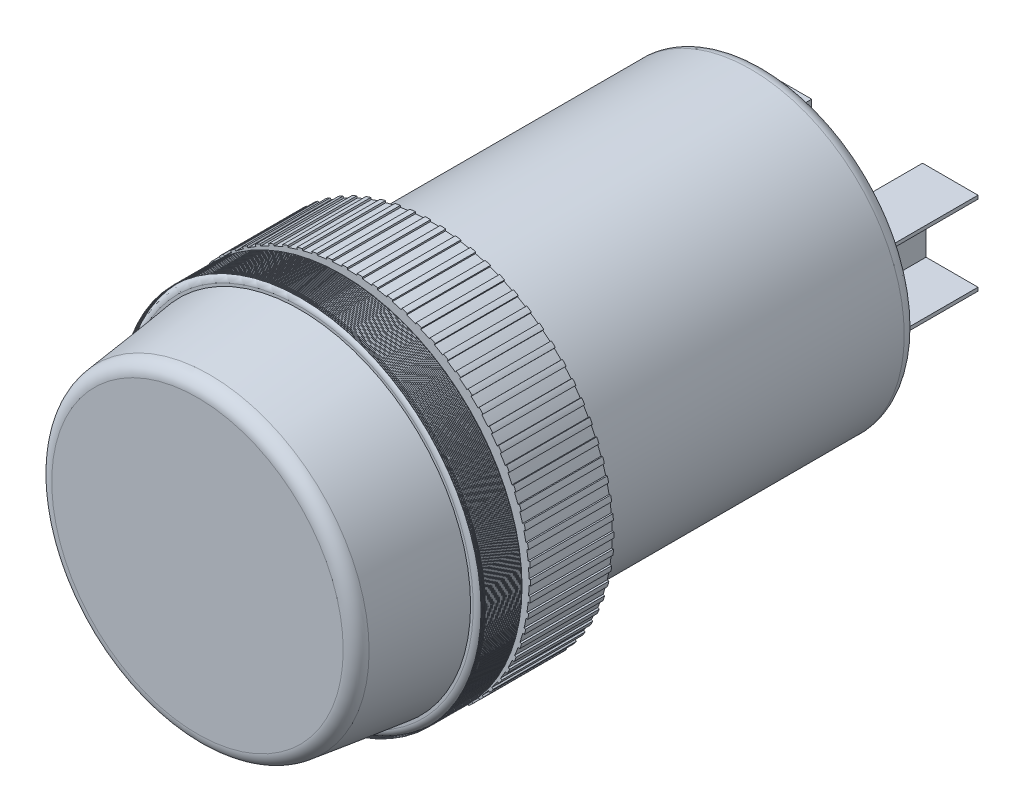
from build123d import *

# Parameters (mm, degrees)
SKETCH1_R           = 14.478
BOSS_EXTRUDE1_DEPTH = 13.208
BOSS_EXTRUDE1_DRAFT = 7
SKETCH2_R           = 16.51
BOSS_EXTRUDE2_DEPTH = 3.81
FILLET1_R           = 1.27
SKETCH6_W           = 0.0254
SKETCH6_H           = 0.0254
SKETCH8_R           = 14.486314935
CUT_EXTRUDE2_DEPTH  = 12.192
CUT_EXTRUDE2_DRAFT  = -7
SKETCH10_R          = 16.51
BOSS_EXTRUDE3_DEPTH = 0.0254
SKETCH11_R          = 15.340889027
BOSS_EXTRUDE4_DEPTH = 0.635
BOSS_EXTRUDE5_START = 7.62
SKETCH12_R          = 16.51
BOSS_EXTRUDE5_DEPTH = 7.62
BOSS_EXTRUDE6_DEPTH = 7.62
SKETCH17_R          = 14.069279536
BOSS_EXTRUDE7_DEPTH = 30.48
FILLET11_R          = 1.27
BOSS_EXTRUDE8_DEPTH = 9.398
SKETCH19_R          = 2.464819315
CUT_EXTRUDE3_DEPTH  = 11.938
SKETCH20_R          = 10.229740141
BOSS_EXTRUDE9_DEPTH = 0.0254
FILLET12_R          = 0.635
SCALE1_SCALE        = 0.2846


# Read off the part's stored shape, not the designer's step: Dome3
with BuildPart() as part:
    # Sketch1 → Boss-Extrude1 (with draft: the straight prism first)
    with BuildSketch(Plane.XY):
        Circle(SKETCH1_R)
    extrude(amount=-BOSS_EXTRUDE1_DEPTH)
    # Boss-Extrude1: the draft: its side faces are tilted about the plane it starts from
    boss_extrude1_sides = [part.faces().sort_by_distance(p)[0] for p in [
        (-14.478, 0, -6.604),
    ]]
    draft(boss_extrude1_sides, Plane.XY, BOSS_EXTRUDE1_DRAFT)

    # Sketch2 → Boss-Extrude2 (add)
    with BuildSketch(Plane(origin=(0, 0, -13.208), x_dir=(-1, 0, 0), z_dir=(0, 0, -1))):
        Circle(SKETCH2_R)
    extrude(amount=-BOSS_EXTRUDE2_DEPTH)

    # Fillet1
    fillet1_edges = [part.edges().sort_by_distance(p)[0] for p in [
        (-14.478, 0, 0),
    ]]
    fillet(fillet1_edges, radius=FILLET1_R)


with BuildPart() as body_2:
    # Sketch6 → Revolve1 (revolve)
    with BuildSketch(Plane(origin=(0, 0, 0), x_dir=(1, 0, 0), z_dir=(0, 1, 0)), mode=Mode.PRIVATE) as revolve1_sk:
        with Locations((-16.523632038, 9.489917197)):
            Rectangle(SKETCH6_W, SKETCH6_H)
        with Locations((-16.523632038, 9.616917197)):
            Rectangle(SKETCH6_W, SKETCH6_H)
        with Locations((-16.523632038, 9.743917197)):
            Rectangle(SKETCH6_W, SKETCH6_H)
        with Locations((-16.523632038, 9.870917197)):
            Rectangle(SKETCH6_W, SKETCH6_H)
        with Locations((-16.523632038, 9.997917197)):
            Rectangle(SKETCH6_W, SKETCH6_H)
        with Locations((-16.523632038, 10.124917197)):
            Rectangle(SKETCH6_W, SKETCH6_H)
        with Locations((-16.523632038, 10.251917197)):
            Rectangle(SKETCH6_W, SKETCH6_H)
        with Locations((-16.523632038, 10.378917197)):
            Rectangle(SKETCH6_W, SKETCH6_H)
        with Locations((-16.523632038, 10.505917197)):
            Rectangle(SKETCH6_W, SKETCH6_H)
        with Locations((-16.523632038, 10.632917197)):
            Rectangle(SKETCH6_W, SKETCH6_H)
        with Locations((-16.523632038, 10.759917197)):
            Rectangle(SKETCH6_W, SKETCH6_H)
        with Locations((-16.523632038, 10.886917197)):
            Rectangle(SKETCH6_W, SKETCH6_H)
        with Locations((-16.523632038, 11.013917197)):
            Rectangle(SKETCH6_W, SKETCH6_H)
        with Locations((-16.523632038, 11.140917197)):
            Rectangle(SKETCH6_W, SKETCH6_H)
        with Locations((-16.523632038, 11.267917197)):
            Rectangle(SKETCH6_W, SKETCH6_H)
        with Locations((-16.523632038, 11.394917197)):
            Rectangle(SKETCH6_W, SKETCH6_H)
        with Locations((-16.523632038, 11.521917197)):
            Rectangle(SKETCH6_W, SKETCH6_H)
        with Locations((-16.523632038, 11.648917197)):
            Rectangle(SKETCH6_W, SKETCH6_H)
        with Locations((-16.523632038, 11.775917197)):
            Rectangle(SKETCH6_W, SKETCH6_H)
        with Locations((-16.523632038, 11.902917197)):
            Rectangle(SKETCH6_W, SKETCH6_H)
        with Locations((-16.523632038, 12.029917197)):
            Rectangle(SKETCH6_W, SKETCH6_H)
        with Locations((-16.523632038, 12.156917197)):
            Rectangle(SKETCH6_W, SKETCH6_H)
        with Locations((-16.523632038, 12.283917197)):
            Rectangle(SKETCH6_W, SKETCH6_H)
        with Locations((-16.523632038, 12.410917197)):
            Rectangle(SKETCH6_W, SKETCH6_H)
        with Locations((-16.523632038, 12.537917197)):
            Rectangle(SKETCH6_W, SKETCH6_H)
        with Locations((-16.523632038, 12.664917197)):
            Rectangle(SKETCH6_W, SKETCH6_H)
        with Locations((-16.523632038, 12.791917197)):
            Rectangle(SKETCH6_W, SKETCH6_H)
        with Locations((-16.523632038, 12.918917197)):
            Rectangle(SKETCH6_W, SKETCH6_H)
        with Locations((-16.523632038, 13.045917197)):
            Rectangle(SKETCH6_W, SKETCH6_H)
        with Locations((-16.523632038, 13.172917197)):
            Rectangle(SKETCH6_W, SKETCH6_H)
    revolve(revolve1_sk.sketch.rotate(Axis((0, 0, 0), (0, 0, -1)), 180), axis=Axis((0, 0, 0), (0, 0, -1)))


with BuildPart() as cut_extrude2_tool:
    # Sketch8 → Cut-Extrude2 (with draft: the straight prism first)
    with BuildSketch(Plane(origin=(0, 0, -13.208), x_dir=(-1, 0, 0), z_dir=(0, 0, -1))):
        Circle(SKETCH8_R)
    extrude(amount=-CUT_EXTRUDE2_DEPTH)
    # Cut-Extrude2: the draft: its side faces are tilted about the plane it starts from
    cut_extrude2_sides = [cut_extrude2_tool.faces().sort_by_distance(p)[0] for p in [
        (14.486314935, 0, -7.112),
    ]]
    draft(cut_extrude2_sides, Plane(origin=(0, 0, -13.208), x_dir=(-1, 0, 0), z_dir=(0, 0, -1)), CUT_EXTRUDE2_DRAFT)


with BuildPart() as part_1:
    add(part.part)

    # Cut-Extrude2: cut by cut_extrude2_tool
    add(cut_extrude2_tool.part, mode=Mode.SUBTRACT)



with BuildPart() as body_3:
    # Sketch10 → Boss-Extrude3 (new body)
    with BuildSketch(Plane.XY.offset(-13.208)):
        with Locations(Location((0, 0, 0), (0, 0, 180))):
            Circle(SKETCH10_R)
    extrude(amount=-BOSS_EXTRUDE3_DEPTH)


with BuildPart() as body_4:
    # Sketch11 → Boss-Extrude4 (new body)
    with BuildSketch(Plane(origin=(0, 0, -13.2334), x_dir=(-1, 0, 0), z_dir=(0, 0, -1))):
        Circle(SKETCH11_R)
    extrude(amount=BOSS_EXTRUDE4_DEPTH)

    # Sketch12 → Boss-Extrude5 (add)
    with BuildSketch(Plane(origin=(0, 0, -13.8684), x_dir=(-1, 0, 0), z_dir=(0, 0, -1)).offset(BOSS_EXTRUDE5_START)):
        with Locations(Location((0, 0, 0), (0, 0, 180))):
            Circle(SKETCH12_R)
    extrude(amount=-BOSS_EXTRUDE5_DEPTH)

    # Sketch13 → Boss-Extrude6 (add)
    with BuildSketch(Plane(origin=(0, 0, -21.4884), x_dir=(-1, 0, 0), z_dir=(0, 0, -1))):
        with BuildLine():
            Line((-16.658236217, 0.289273295), (-16.22758347, 0.289273295))
            Line((-16.22758347, 0.289273295), (-16.22758347, -0.218726705))
            Line((-16.22758347, -0.218726705), (-16.658236217, -0.218726705))
            ThreePointArc((-16.658236217, -0.218726705), (-16.671094049, 0.035273295), (-16.658236217, 0.289273295))
        make_face()
        with BuildLine():
            Line((-16.618116017, 1.17596568), (-16.188973629, 1.139929587))
            Line((-16.188973629, 1.139929587), (-16.146465285, 1.64614796))
            Line((-16.146465285, 1.64614796), (-16.575607672, 1.682184053))
            ThreePointArc((-16.575607672, 1.682184053), (-16.609674583, 1.430150782), (-16.618116017, 1.17596568))
        make_face()
        with BuildLine():
            Line((-16.461431673, 2.562409512), (-16.036809771, 2.490590093))
            Line((-16.036809771, 2.490590093), (-15.952091247, 2.99147608))
            Line((-15.952091247, 2.99147608), (-16.376713149, 3.063295498))
            ThreePointArc((-16.376713149, 3.063295498), (-16.431750183, 2.81499679), (-16.461431673, 2.562409512))
        make_face()
        with BuildLine():
            Line((-16.189282213, 3.930879881), (-15.772159214, 3.823780898))
            Line((-15.772159214, 3.823780898), (-15.645824751, 4.315821144))
            Line((-15.645824751, 4.315821144), (-16.062947751, 4.422920127))
            ThreePointArc((-16.062947751, 4.422920127), (-16.138568862, 4.180097617), (-16.189282213, 3.930879881))
        make_face()
        with BuildLine():
            Line((-15.803576571, 5.271777953), (-15.396878293, 5.130150628))
            Line((-15.396878293, 5.130150628), (-15.229814036, 5.609893824))
            Line((-15.229814036, 5.609893824), (-15.636512314, 5.751521149))
            ThreePointArc((-15.636512314, 5.751521149), (-15.732187076, 5.515878063), (-15.803576571, 5.271777953))
        make_face()
        with BuildLine():
            Line((-15.307020194, 6.57569829), (-14.913599333, 6.400536037))
            Line((-14.913599333, 6.400536037), (-14.706977118, 6.86461713))
            Line((-14.706977118, 6.86461713), (-15.100397979, 7.039779383))
            ThreePointArc((-15.100397979, 7.039779383), (-15.215455301, 6.812968588), (-15.307020194, 6.57569829))
        make_face()
        with BuildLine():
            Line((-14.703096068, 7.833494828), (-14.325712189, 7.626026285))
            Line((-14.325712189, 7.626026285), (-14.080981323, 8.071190079))
            Line((-14.080981323, 8.071190079), (-14.458365202, 8.278658622))
            ThreePointArc((-14.458365202, 8.278658622), (-14.59199804, 8.062271033), (-14.703096068, 7.833494828))
        make_face()
        with BuildLine():
            Line((-13.996040288, 9.036345029), (-13.637340468, 8.798025438))
            Line((-13.637340468, 8.798025438), (-13.356217561, 9.221149428))
            Line((-13.356217561, 9.221149428), (-13.714917381, 9.459469019))
            ThreePointArc((-13.714917381, 9.459469019), (-13.866188397, 9.25502244), (-13.996040288, 9.036345029))
        make_face()
        with BuildLine():
            Line((-13.190812341, 10.175811761), (-12.853312601, 9.908312763))
            Line((-12.853312601, 9.908312763), (-12.537769529, 10.30642904))
            Line((-12.537769529, 10.30642904), (-12.875269269, 10.573928038))
            ThreePointArc((-12.875269269, 10.573928038), (-13.043117404, 10.382856514), (-13.190812341, 10.175811761))
        make_face()
        with BuildLine():
            Line((-12.293060323, 11.243902486), (-11.979127981, 10.949100394))
            Line((-11.979127981, 10.949100394), (-11.631378052, 11.319416457))
            Line((-11.631378052, 11.319416457), (-11.945310393, 11.614218549))
            ThreePointArc((-11.945310393, 11.614218549), (-12.128558315, 11.437862309), (-12.293060323, 11.243902486))
        make_face()
        with BuildLine():
            Line((-11.30908132, 12.233125313), (-11.020918386, 11.913087952))
            Line((-11.020918386, 11.913087952), (-10.643400815, 12.2530063))
            Line((-10.643400815, 12.2530063), (-10.931563749, 12.573043661))
            ThreePointArc((-10.931563749, 12.573043661), (-11.128926104, 12.412639719), (-11.30908132, 12.233125313))
        make_face()
        with BuildLine():
            Line((-10.245777236, 13.136541556), (-9.985404967, 12.793513758))
            Line((-9.985404967, 12.793513758), (-9.580767768, 13.100650109))
            Line((-9.580767768, 13.100650109), (-9.841140038, 13.443677906))
            ThreePointArc((-9.841140038, 13.443677906), (-10.051232472, 13.300351379), (-10.245777236, 13.136541556))
        make_face()
        with BuildLine():
            Line((-9.110606387, 13.947814398), (-8.879851106, 13.584202257))
            Line((-8.879851106, 13.584202257), (-8.45093252, 13.856402269))
            Line((-8.45093252, 13.856402269), (-8.681687801, 14.22001441))
            ThreePointArc((-8.681687801, 14.22001441), (-8.903036666, 14.094770631), (-9.110606387, 13.947814398))
        make_face()
        with BuildLine():
            Line((-7.91153118, 14.661253344), (-7.71201147, 14.279607338))
            Line((-7.71201147, 14.279607338), (-7.261820052, 14.514961724))
            Line((-7.261820052, 14.514961724), (-7.461339762, 14.896607729))
            ThreePointArc((-7.461339762, 14.896607729), (-7.692392454, 14.790325194), (-7.91153118, 14.661253344))
        make_face()
        with BuildLine():
            Line((-6.656962267, 15.271854131), (-6.490077615, 14.874851232))
            Line((-6.490077615, 14.874851232), (-6.021771134, 15.07170915))
            Line((-6.021771134, 15.07170915), (-6.188655786, 15.468712049))
            ThreePointArc((-6.188655786, 15.468712049), (-6.427791637, 15.382136252), (-6.656962267, 15.271854131))
        make_face()
        with BuildLine():
            Line((-5.355699546, 15.775333835), (-5.222620528, 15.365758733))
            Line((-5.222620528, 15.365758733), (-4.739483818, 15.522739367))
            Line((-4.739483818, 15.522739367), (-4.872562835, 15.932314468))
            ThreePointArc((-4.872562835, 15.932314468), (-5.118104479, 15.866052677), (-5.355699546, 15.775333835))
        make_face()
        with BuildLine():
            Line((-4.01687044, 16.168160906), (-3.918530511, 15.748886477))
            Line((-3.918530511, 15.748886477), (-3.423952428, 15.864888719))
            Line((-3.423952428, 15.864888719), (-3.522292358, 16.284163148))
            ThreePointArc((-3.522292358, 16.284163148), (-3.772517496, 16.238680142), (-4.01687044, 16.168160906))
        make_face()
        with BuildLine():
            Line((-2.649865875, 16.447579946), (-2.586954818, 16.021547098))
            Line((-2.586954818, 16.021547098), (-2.084404472, 16.095757276))
            Line((-2.084404472, 16.095757276), (-2.14731553, 16.521790124))
            ThreePointArc((-2.14731553, 16.521790124), (-2.400469014, 16.497404933), (-2.649865875, 16.447579946))
        make_face()
        with BuildLine():
            Line((-1.264274405, 16.611631029), (-1.237233495, 16.181828077))
            Line((-1.237233495, 16.181828077), (-0.730235917, 16.213725661))
            Line((-0.730235917, 16.213725661), (-0.757276827, 16.643528613))
            ThreePointArc((-0.757276827, 16.643528613), (-1.011582966, 16.640412282), (-1.264274405, 16.611631029))
        make_face()
        with BuildLine():
            Line((0.130185042, 16.659163457), (0.121166132, 16.228605159))
            Line((0.121166132, 16.228605159), (0.629054719, 16.21796641))
            Line((0.629054719, 16.21796641), (0.63807363, 16.648524707))
            ThreePointArc((0.63807363, 16.648524707), (0.38439861, 16.666699095), (0.130185042, 16.659163457))
        make_face()
        with BuildLine():
            Line((1.523731335, 16.589843822), (1.478715865, 16.161550236))
            Line((1.478715865, 16.161550236), (1.983932988, 16.108449776))
            Line((1.983932988, 16.108449776), (2.028948458, 16.536743363))
            ThreePointArc((2.028948458, 16.536743363), (1.777683906, 16.576080989), (1.523731335, 16.589843822))
        make_face()
        with BuildLine():
            Line((2.906589747, 16.404158353), (2.825893469, 15.98113365))
            Line((2.825893469, 15.98113365), (3.324895392, 15.885943942))
            Line((3.324895392, 15.885943942), (3.40559167, 16.308968645))
            ThreePointArc((3.40559167, 16.308968645), (3.158500026, 16.369193584), (2.906589747, 16.404158353))
        make_face()
        with BuildLine():
            Line((4.26906052, 16.103409499), (4.153249461, 15.688620894))
            Line((4.153249461, 15.688620894), (4.642536045, 15.552009625))
            Line((4.642536045, 15.552009625), (4.758347104, 15.96679823))
            ThreePointArc((4.758347104, 15.96679823), (4.517161538, 16.047488048), (4.26906052, 16.103409499))
        make_face()
        with BuildLine():
            Line((5.601586901, 15.689706798), (5.451473391, 15.286063735))
            Line((5.451473391, 15.286063735), (5.927612642, 15.108989135))
            Line((5.927612642, 15.108989135), (6.077726152, 15.512632198))
            ThreePointArc((6.077726152, 15.512632198), (5.844138408, 15.613220913), (5.601586901, 15.689706798))
        make_face()
        with BuildLine():
            Line((6.894822175, 15.165952077), (6.711459153, 14.776285821))
            Line((6.711459153, 14.776285821), (7.171111296, 14.559989941))
            Line((7.171111296, 14.559989941), (7.354474318, 14.949656197))
            ThreePointArc((7.354474318, 14.949656197), (7.130122845, 15.069438252), (6.894822175, 15.165952077))
        make_face()
        with BuildLine():
            Line((8.139695225, 14.535819099), (7.924368851, 14.162862879))
            Line((7.924368851, 14.162862879), (8.364309757, 13.908862879))
            Line((8.364309757, 13.908862879), (8.57963613, 14.281819099))
            ThreePointArc((8.57963613, 14.281819099), (8.366094594, 14.419954308), (8.139695225, 14.535819099))
        make_face()
        with BuildLine():
            Line((9.327474161, 13.803727793), (9.081694796, 13.450097631))
            Line((9.081694796, 13.450097631), (9.498838594, 13.160175138))
            Line((9.498838594, 13.160175138), (9.74461796, 13.513805301))
            ThreePointArc((9.74461796, 13.513805301), (9.5433842, 13.669324746), (9.327474161, 13.803727793))
        make_face()
        with BuildLine():
            Line((10.449827568, 12.974813255), (10.175319176, 12.642989611))
            Line((10.175319176, 12.642989611), (10.566739903, 12.319178224))
            Line((10.566739903, 12.319178224), (10.841248296, 12.651001869))
            ThreePointArc((10.841248296, 12.651001869), (10.653733823, 12.822814692), (10.449827568, 12.974813255))
        make_face()
        with BuildLine():
            Line((11.498882943, 12.054889725), (11.197571003, 11.747200103))
            Line((11.197571003, 11.747200103), (11.560523125, 11.391771126))
            Line((11.560523125, 11.391771126), (11.861835064, 11.699460748))
            ThreePointArc((11.861835064, 11.699460748), (11.689355158, 11.886361807), (11.498882943, 12.054889725))
        make_face()
        with BuildLine():
            Line((12.467281916, 11.050409805), (12.141279916, 10.769012427))
            Line((12.141279916, 10.769012427), (12.473217583, 10.384458938))
            Line((12.473217583, 10.384458938), (12.799219583, 10.665856316))
            ThreePointArc((12.799219583, 10.665856316), (12.642984065, 10.866534633), (12.467281916, 11.050409805))
        make_face()
        with BuildLine():
            Line((13.348231864, 9.968419199), (12.999826473, 9.715287866))
            Line((12.999826473, 9.715287866), (13.298421381, 9.304307232))
            Line((13.298421381, 9.304307232), (13.646826772, 9.557438566))
            ThreePointArc((13.646826772, 9.557438566), (13.507931523, 9.770486527), (13.348231864, 9.968419199))
        make_face()
        with BuildLine():
            Line((14.135553556, 8.816507295), (13.767188588, 8.593417541))
            Line((13.767188588, 8.593417541), (14.030346308, 8.158892496))
            Line((14.030346308, 8.158892496), (14.398711277, 8.381982251))
            ThreePointArc((14.398711277, 8.381982251), (14.278130547, 8.605905478), (14.135553556, 8.816507295))
        make_face()
        with BuildLine():
            Line((14.823724496, 7.602753927), (14.437983766, 7.411270566))
            Line((14.437983766, 7.411270566), (14.663858437, 6.956248992))
            Line((14.663858437, 6.956248992), (15.049599167, 7.147732353))
            ThreePointArc((15.049599167, 7.147732353), (14.948178744, 7.380960185), (14.823724496, 7.602753927))
        make_face()
        with BuildLine():
            Line((15.40791766, 6.335672703), (15.007506862, 6.177138853))
            Line((15.007506862, 6.177138853), (15.194514135, 5.704812399))
            Line((15.194514135, 5.704812399), (15.594924933, 5.863346248))
            ThreePointArc((15.594924933, 5.863346248), (15.513376207, 6.10424276), (15.40791766, 6.335672703))
        make_face()
        with BuildLine():
            Line((15.884035352, 5.024151287), (15.471763081, 4.89967895))
            Line((15.471763081, 4.89967895), (15.618591233, 4.413360645))
            Line((15.618591233, 4.413360645), (16.030863505, 4.537832983))
            ThreePointArc((16.030863505, 4.537832983), (15.969758482, 4.784708457), (15.884035352, 5.024151287))
        make_face()
        with BuildLine():
            Line((16.248737949, 3.67738906), (15.827495997, 3.587851319))
            Line((15.827495997, 3.587851319), (15.933115136, 3.090952338))
            Line((15.933115136, 3.090952338), (16.354357088, 3.180490079))
            ThreePointArc((16.354357088, 3.180490079), (16.314124376, 3.431612863), (16.248737949, 3.67738906))
        make_face()
        with BuildLine():
            Line((16.499467323, 2.304832591), (16.072210402, 2.250857489))
            Line((16.072210402, 2.250857489), (16.135879684, 1.746863221))
            Line((16.135879684, 1.746863221), (16.563136606, 1.800838322))
            ThreePointArc((16.563136606, 1.800838322), (16.54405841, 2.05444697), (16.499467323, 2.304832591))
        make_face()
        with BuildLine():
            Line((16.634464789, 0.916109376), (16.204189798, 0.898075511))
            Line((16.204189798, 0.898075511), (16.22546263, 0.390521113))
            Line((16.22546263, 0.390521113), (16.655737622, 0.408554979))
            ThreePointArc((16.655737622, 0.408554979), (16.65794776, 0.662870608), (16.634464789, 0.916109376))
        make_face()
        with BuildLine():
            Line((16.652783437, -0.479039687), (16.222508446, -0.461005821))
            Line((16.222508446, -0.461005821), (16.201235614, -0.968560219))
            Line((16.201235614, -0.968560219), (16.631510605, -0.986594084))
            ThreePointArc((16.631510605, -0.986594084), (16.654993575, -0.733355316), (16.652783437, -0.479039687))
        make_face()
        with BuildLine():
            Line((16.554294774, -1.870828631), (16.127037852, -1.816853529))
            Line((16.127037852, -1.816853529), (16.06336857, -2.320847797))
            Line((16.06336857, -2.320847797), (16.490625491, -2.374822899))
            ThreePointArc((16.490625491, -2.374822899), (16.535216577, -2.124437278), (16.554294774, -1.870828631))
        make_face()
        with BuildLine():
            Line((16.339689627, -3.249495056), (15.918447676, -3.159957315))
            Line((15.918447676, -3.159957315), (15.812828537, -3.656856296))
            Line((15.812828537, -3.656856296), (16.234070488, -3.746394037))
            ThreePointArc((16.234070488, -3.746394037), (16.299456916, -3.50061784), (16.339689627, -3.249495056))
        make_face()
        with BuildLine():
            Line((16.010473297, -4.605368608), (15.598201026, -4.480896271))
            Line((15.598201026, -4.480896271), (15.451372873, -4.967214575))
            Line((15.451372873, -4.967214575), (15.863645145, -5.091686913))
            ThreePointArc((15.863645145, -5.091686913), (15.949368275, -4.852244083), (16.010473297, -4.605368608))
        make_face()
        with BuildLine():
            Line((15.568955001, -5.928938808), (15.168544203, -5.770404958))
            Line((15.168544203, -5.770404958), (14.981536931, -6.242731413))
            Line((14.981536931, -6.242731413), (15.381947728, -6.401265263))
            ThreePointArc((15.381947728, -6.401265263), (15.487406275, -6.16983532), (15.568955001, -5.928938808))
        make_face()
        with BuildLine():
            Line((15.018231672, -7.210921763), (14.632490942, -7.019438401))
            Line((14.632490942, -7.019438401), (14.406616271, -7.474459976))
            Line((14.406616271, -7.474459976), (14.792357001, -7.665943337))
            ThreePointArc((14.792357001, -7.665943337), (14.916811248, -7.444149595), (15.018231672, -7.210921763))
        make_face()
        with BuildLine():
            Line((14.362166238, -8.442325282), (13.99380127, -8.219235528))
            Line((13.99380127, -8.219235528), (13.730643549, -8.653760572))
            Line((13.730643549, -8.653760572), (14.099008517, -8.876850326))
            ThreePointArc((14.099008517, -8.876850326), (14.241585508, -8.666248509), (14.362166238, -8.442325282))
        make_face()
        with BuildLine():
            Line((13.605360527, -9.614511956), (13.256955136, -9.361380622))
            Line((13.256955136, -9.361380622), (12.958360228, -9.772361255))
            Line((12.958360228, -9.772361255), (13.306765619, -10.025492589))
            ThreePointArc((13.306765619, -10.025492589), (13.466465278, -9.827559917), (13.605360527, -9.614511956))
        make_face()
        with BuildLine():
            Line((12.753122988, -10.719259736), (12.427120988, -10.437862357))
            Line((12.427120988, -10.437862357), (12.095183321, -10.822415846))
            Line((12.095183321, -10.822415846), (12.421185321, -11.103813224))
            ThreePointArc((12.421185321, -11.103813224), (12.59688747, -10.919938053), (12.753122988, -10.719259736))
        make_face()
        with BuildLine():
            Line((11.811431454, -11.74881961), (11.510119514, -11.441129988))
            Line((11.510119514, -11.441129988), (11.147167393, -11.796558965))
            Line((11.147167393, -11.796558965), (11.448479332, -12.104248587))
            ThreePointArc((11.448479332, -12.104248587), (11.638951547, -11.935720669), (11.811431454, -11.74881961))
        make_face()
        with BuildLine():
            Line((10.786891214, -12.695969957), (10.512382822, -12.364146312))
            Line((10.512382822, -12.364146312), (10.120962095, -12.687957699))
            Line((10.120962095, -12.687957699), (10.395470487, -13.019781344))
            ThreePointArc((10.395470487, -13.019781344), (10.599376742, -12.867782781), (10.786891214, -12.695969957))
        make_face()
        with BuildLine():
            Line((9.686688684, -13.554067197), (9.440909318, -13.200437034))
            Line((9.440909318, -13.200437034), (9.02376552, -13.490359526))
            Line((9.02376552, -13.490359526), (9.269544885, -13.843989689))
            ThreePointArc((9.269544885, -13.843989689), (9.485454924, -13.709586642), (9.686688684, -13.554067197))
        make_face()
        with BuildLine():
            Line((8.518540992, -14.317092393), (8.303214618, -13.944136174))
            Line((8.303214618, -13.944136174), (7.863273713, -14.198136174))
            Line((7.863273713, -14.198136174), (8.078600087, -14.571092393))
            ThreePointArc((8.078600087, -14.571092393), (8.304999456, -14.455227603), (8.518540992, -14.317092393))
        make_face()
        with BuildLine():
            Line((7.290641855, -14.979693474), (7.107278834, -14.590027218))
            Line((7.107278834, -14.590027218), (6.647626691, -14.806323098))
            Line((6.647626691, -14.806323098), (6.830989713, -15.195989354))
            ThreePointArc((6.830989713, -15.195989354), (7.066290383, -15.099475529), (7.290641855, -14.979693474))
        make_face()
        with BuildLine():
            Line((6.011604104, -15.537222767), (5.861490595, -15.133579704))
            Line((5.861490595, -15.133579704), (5.385351344, -15.310654304))
            Line((5.385351344, -15.310654304), (5.535464854, -15.714297367))
            ThreePointArc((5.535464854, -15.714297367), (5.77801636, -15.637811482), (6.011604104, -15.537222767))
        make_face()
        with BuildLine():
            Line((4.69039927, -15.985769606), (4.574588211, -15.570981001))
            Line((4.574588211, -15.570981001), (4.085301627, -15.70759227))
            Line((4.085301627, -15.70759227), (4.201112686, -16.122380875))
            ThreePointArc((4.201112686, -16.122380875), (4.449213704, -16.066459424), (4.69039927, -15.985769606))
        make_face()
        with BuildLine():
            Line((3.336294655, -16.322187758), (3.255598377, -15.899163055))
            Line((3.255598377, -15.899163055), (2.756596454, -15.994352763))
            Line((2.756596454, -15.994352763), (2.837292732, -16.417377465))
            ThreePointArc((2.837292732, -16.417377465), (3.089203011, -16.382412697), (3.336294655, -16.322187758))
        make_face()
        with BuildLine():
            Line((1.95878833, -16.544117489), (1.91377286, -16.115823903))
            Line((1.91377286, -16.115823903), (1.408555737, -16.168924362))
            Line((1.408555737, -16.168924362), (1.453571207, -16.597217949))
            ThreePointArc((1.453571207, -16.597217949), (1.707523778, -16.583455115), (1.95878833, -16.544117489))
        make_face()
        with BuildLine():
            Line((0.567542512, -16.650002124), (0.558523602, -16.219443826))
            Line((0.558523602, -16.219443826), (0.050635015, -16.230082575))
            Line((0.050635015, -16.230082575), (0.059653925, -16.660640873))
            ThreePointArc((0.059653925, -16.660640873), (0.313867493, -16.668176511), (0.567542512, -16.650002124))
        make_face()
        with BuildLine():
            Line((-0.827684208, -16.639098956), (-0.800643299, -16.209296004))
            Line((-0.800643299, -16.209296004), (-1.307640877, -16.17739842))
            Line((-1.307640877, -16.17739842), (-1.334681786, -16.607201372))
            ThreePointArc((-1.334681786, -16.607201372), (-1.081990347, -16.635982625), (-0.827684208, -16.639098956))
        make_face()
        with BuildLine():
            Line((-2.217105319, -16.511484465), (-2.154194261, -16.085451617))
            Line((-2.154194261, -16.085451617), (-2.656744607, -16.011241438))
            Line((-2.656744607, -16.011241438), (-2.719655664, -16.437274286))
            ThreePointArc((-2.719655664, -16.437274286), (-2.470258803, -16.487099274), (-2.217105319, -16.511484465))
        make_face()
        with BuildLine():
            Line((-3.590975029, -16.268053773), (-3.492635099, -15.848779344))
            Line((-3.492635099, -15.848779344), (-3.987213182, -15.732777102))
            Line((-3.987213182, -15.732777102), (-4.085553111, -16.152051531))
            ThreePointArc((-4.085553111, -16.152051531), (-3.841200167, -16.222570767), (-3.590975029, -16.268053773))
        make_face()
        with BuildLine():
            Line((-4.939656629, -15.910514373), (-4.806577611, -15.500939272))
            Line((-4.806577611, -15.500939272), (-5.289714322, -15.343958638))
            Line((-5.289714322, -15.343958638), (-5.422793339, -15.75353374))
            ThreePointArc((-5.422793339, -15.75353374), (-5.185198273, -15.844252582), (-4.939656629, -15.910514373))
        make_face()
        with BuildLine():
            Line((-6.253690087, -15.441374146), (-6.086805435, -15.044371247))
            Line((-6.086805435, -15.044371247), (-6.555111916, -14.84751333))
            Line((-6.555111916, -14.84751333), (-6.721996568, -15.244516228))
            ThreePointArc((-6.721996568, -15.244516228), (-6.492825938, -15.354798349), (-6.253690087, -15.441374146))
        make_face()
        with BuildLine():
            Line((-7.523858402, -14.863923774), (-7.324338692, -14.482277768))
            Line((-7.324338692, -14.482277768), (-7.77453011, -14.246923383))
            Line((-7.77453011, -14.246923383), (-7.97404982, -14.628569388))
            ThreePointArc((-7.97404982, -14.628569388), (-7.754911094, -14.757641239), (-7.523858402, -14.863923774))
        make_face()
        with BuildLine():
            Line((-8.741252257, -14.182213657), (-8.510496975, -13.818601516))
            Line((-8.510496975, -13.818601516), (-8.939415562, -13.546401504))
            Line((-8.939415562, -13.546401504), (-9.170170843, -13.910013645))
            ThreePointArc((-9.170170843, -13.910013645), (-8.962601121, -14.056969878), (-8.741252257, -14.182213657))
        make_face()
        with BuildLine():
            Line((-9.897332507, -13.401025501), (-9.636960237, -13.057997703))
            Line((-9.636960237, -13.057997703), (-10.041597436, -12.750861353))
            Line((-10.041597436, -12.750861353), (-10.301969705, -13.09388915))
            ThreePointArc((-10.301969705, -13.09388915), (-10.107424941, -13.257698974), (-9.897332507, -13.401025501))
        make_face()
        with BuildLine():
            Line((-10.983990081, -12.525838779), (-10.695827147, -12.205801418))
            Line((-10.695827147, -12.205801418), (-11.073344719, -11.86588307))
            Line((-11.073344719, -11.86588307), (-11.361507653, -12.185920431))
            ThreePointArc((-11.361507653, -12.185920431), (-11.181352436, -12.365434837), (-10.983990081, -12.525838779))
        make_face()
        with BuildLine():
            Line((-11.993602857, -11.562792298), (-11.679670515, -11.267990207))
            Line((-11.679670515, -11.267990207), (-12.027420445, -10.897674144))
            Line((-12.027420445, -10.897674144), (-12.341352787, -11.192476235))
            ThreePointArc((-12.341352787, -11.192476235), (-12.176850779, -11.386436059), (-11.993602857, -11.562792298))
        make_face()
        with BuildLine():
            Line((-12.919089126, -10.518641137), (-12.581589386, -10.251142139))
            Line((-12.581589386, -10.251142139), (-12.897132458, -9.853025863))
            Line((-12.897132458, -9.853025863), (-13.234632198, -10.120524861))
            ThreePointArc((-13.234632198, -10.120524861), (-13.086937262, -10.327569613), (-12.919089126, -10.518641137))
        make_face()
        with BuildLine():
            Line((-13.753957267, -9.400709266), (-13.395257447, -9.162389676))
            Line((-13.395257447, -9.162389676), (-13.676380354, -8.739265685))
            Line((-13.676380354, -8.739265685), (-14.035080174, -8.977585276))
            ThreePointArc((-14.035080174, -8.977585276), (-13.905228283, -9.196262687), (-13.753957267, -9.400709266))
        make_face()
        with BuildLine():
            Line((-14.49235128, -8.216838174), (-14.114967401, -8.009369631))
            Line((-14.114967401, -8.009369631), (-14.359698268, -7.564205838))
            Line((-14.359698268, -7.564205838), (-14.737082147, -7.771674381))
            ThreePointArc((-14.737082147, -7.771674381), (-14.625984118, -8.000450586), (-14.49235128, -8.216838174))
        make_face()
        with BuildLine():
            Line((-15.129091862, -6.975331867), (-14.735671001, -6.800169614))
            Line((-14.735671001, -6.800169614), (-14.942293216, -6.336088521))
            Line((-14.942293216, -6.336088521), (-15.335714077, -6.511250774))
            ThreePointArc((-15.335714077, -6.511250774), (-15.244149184, -6.748521072), (-15.129091862, -6.975331867))
        make_face()
        with BuildLine():
            Line((-15.659712735, -5.684898617), (-15.253014457, -5.543271292))
            Line((-15.253014457, -5.543271292), (-15.420078713, -5.063528096))
            Line((-15.420078713, -5.063528096), (-15.826776991, -5.205155421))
            ThreePointArc((-15.826776991, -5.205155421), (-15.755387496, -5.449255532), (-15.659712735, -5.684898617))
        make_face()
        with BuildLine():
            Line((-16.080491974, -4.354589889), (-15.663368975, -4.247490906))
            Line((-15.663368975, -4.247490906), (-15.789703437, -3.75545066))
            Line((-15.789703437, -3.75545066), (-16.206826437, -3.862549643))
            ThreePointArc((-16.206826437, -3.862549643), (-16.156113086, -4.111767379), (-16.080491974, -4.354589889))
        make_face()
        with BuildLine():
            Line((-16.388478116, -2.993736841), (-15.963856214, -2.921917422))
            Line((-15.963856214, -2.921917422), (-16.048574737, -2.421031435))
            Line((-16.048574737, -2.421031435), (-16.473196639, -2.492850854))
            ThreePointArc((-16.473196639, -2.492850854), (-16.44351515, -2.745438132), (-16.388478116, -2.993736841))
        make_face()
        with BuildLine():
            Line((-16.581510859, -1.61188488), (-16.152368471, -1.575848787))
            Line((-16.152368471, -1.575848787), (-16.194876816, -1.069630415))
            Line((-16.194876816, -1.069630415), (-16.624019203, -1.105666508))
            ThreePointArc((-16.624019203, -1.105666508), (-16.615577769, -1.35985161), (-16.581510859, -1.61188488))
        make_face()
    extrude(amount=-BOSS_EXTRUDE6_DEPTH)


with BuildPart() as body_5:
    # Sketch17 → Boss-Extrude7 (new body)
    with BuildSketch(Plane(origin=(0, 0, -21.4884), x_dir=(-1, 0, 0), z_dir=(0, 0, -1))):
        with Locations(Location((0, 0, 0), (0, 0, 180))):
            Circle(SKETCH17_R)
    extrude(amount=BOSS_EXTRUDE7_DEPTH)

    # Fillet11
    fillet11_edges = [body_5.edges().sort_by_distance(p)[0] for p in [
        (-14.069279536, 0, -51.9684),
    ]]
    fillet(fillet11_edges, radius=FILLET11_R)

    # Sketch18 → Boss-Extrude8 (add)
    with BuildSketch(Plane(origin=(0, 0, -51.9684), x_dir=(-1, 0, 0), z_dir=(0, 0, -1))):
        Polygon((5.08, 3.81), (5.08, -3.81), (10.16, -3.81), (10.16, -3.4925), (5.3975, -3.4925), (5.3975, 3.4925), (10.16, 3.4925), (10.16, 3.81), align=None)
        Polygon((-10.16, 3.4925), (-10.16, 3.81), (-5.08, 3.81), (-5.08, -3.81), (-10.16, -3.81), (-10.16, -3.4925), (-5.3975, -3.4925), (-5.3975, 3.4925), align=None)
    extrude(amount=BOSS_EXTRUDE8_DEPTH)

    # Sketch19 → Cut-Extrude3 (cut)
    with BuildSketch(Plane.ZY.offset(5.3975)):
        with Locations(Location((-56.5912, 0, 0), (0, 0, 180))):
            Circle(SKETCH19_R)
    extrude(amount=-CUT_EXTRUDE3_DEPTH, mode=Mode.SUBTRACT)


with BuildPart() as part_2:
    add(part_1.part)

    add(body_3.part)  # Boss-Extrude9 merges body 3
    # Sketch20 → Boss-Extrude9 (add)
    with BuildSketch(Plane.XY.offset(-13.208)):
        Circle(SKETCH20_R)
    extrude(amount=BOSS_EXTRUDE9_DEPTH)

    # Dome3 outline → Dome3 (revolve)
    with BuildSketch(Plane.XZ):
        with BuildLine():
            Line((0, -13.1826), (10.229740144, -13.18260001))
            ThreePointArc((10.229740144, -13.18260001), (6.377930377, -7.676959757), (0, -5.5626))
            Line((0, -5.5626), (0, -13.1826))
        make_face()
    revolve(axis=Axis((0, 0, 0), (0, 0, 1)))

    # Fillet12
    fillet12_edges = [part_2.edges().sort_by_distance(p)[0] for p in [
        (16.51, 0, -9.398),
    ]]
    fillet(fillet12_edges, radius=FILLET12_R)


with BuildPart() as body_2_1:
    # Scale1: scaled about (0, 0, 0)
    add(body_2.part.scale(SCALE1_SCALE))


with BuildPart() as part_3:
    # Scale1: scaled about (0, 0, 0)
    add(part_2.part.scale(SCALE1_SCALE))


with BuildPart() as body_5_1:
    # Scale1: scaled about (0, 0, 0)
    add(body_5.part.scale(SCALE1_SCALE))


with BuildPart() as body_4_1:
    # Scale1: scaled about (0, 0, 0)
    add(body_4.part.scale(SCALE1_SCALE))


solid = Compound([body_2_1.part, part_3.part, body_5_1.part, body_4_1.part])
